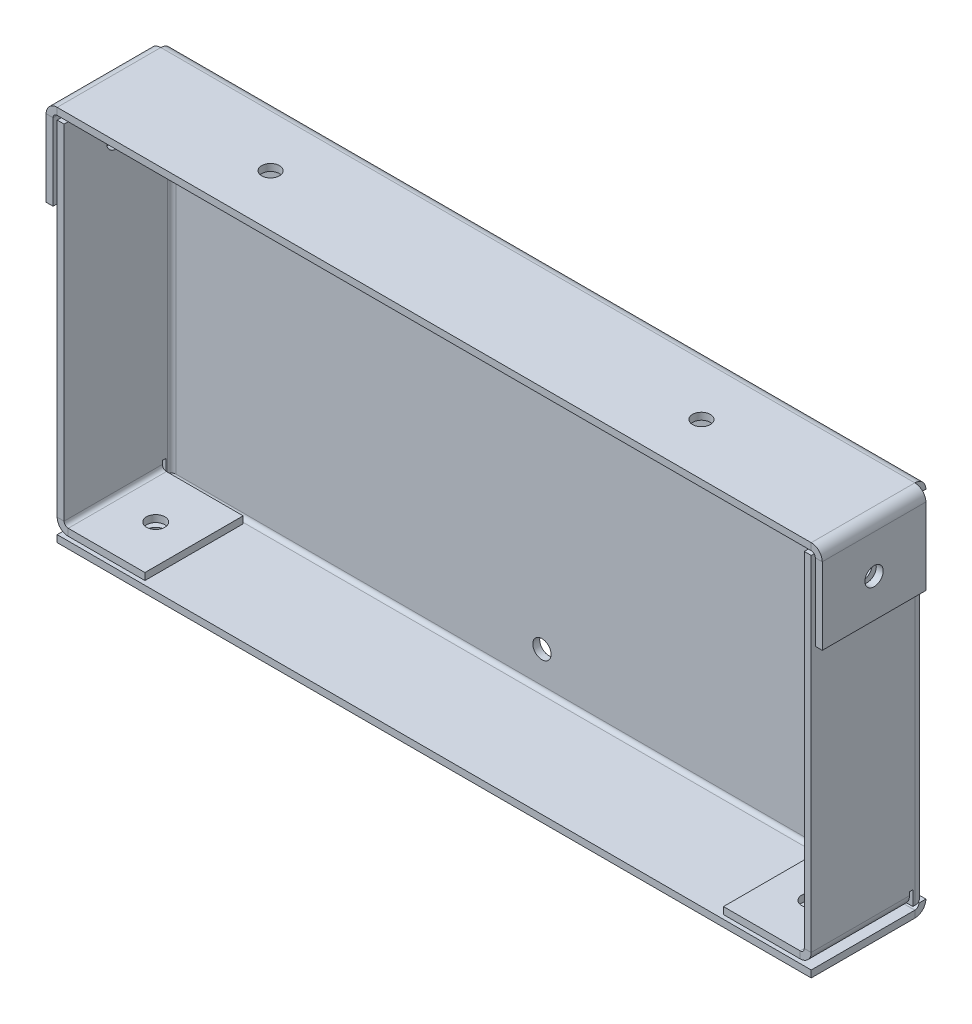
from build123d import *

# Parameters (mm, degrees)
SKETCH1_W                        = 140
SKETCH1_H                        = 70
BASE_FLANGE1_DEPTH               = 1.29
EDGE_FLANGE1_STRIP_W             = 6.684
EDGE_FLANGE1_STRIP_H             = 1.29
EDGE_FLANGE1_STRIP_CUT_DEPTH     = 140
EDGE_FLANGE1_DEPTH               = 140
EDGE_FLANGE2_STRIP_W             = 6.684
EDGE_FLANGE2_STRIP_H             = 1.29
EDGE_FLANGE2_STRIP_CUT_DEPTH     = 140
EDGE_FLANGE2_DEPTH               = 140
EDGE_FLANGE3_STRIP_W             = 6.684
EDGE_FLANGE3_STRIP_H             = 1.29
EDGE_FLANGE3_STRIP_CUT_DEPTH     = 65.896
EDGE_FLANGE3_DEPTH               = 65.896
EDGE_FLANGE4_STRIP_W             = 6.684
EDGE_FLANGE4_STRIP_H             = 1.29
EDGE_FLANGE4_STRIP_CUT_DEPTH     = 65.896
EDGE_FLANGE4_DEPTH               = 65.896
EDGE_FLANGE6_START               = 1.117
EDGE_FLANGE6_DEPTH               = 18.883
EDGE_FLANGE6_2_DEPTH             = 0.645
EDGE_FLANGE6_START_2             = 1.762
EDGE_FLANGE6_3_DEPTH             = 18.238
EDGE_FLANGE8_START               = 1.117
EDGE_FLANGE8_DEPTH               = 18.883
EDGE_FLANGE8_2_DEPTH             = 0.645
EDGE_FLANGE8_START_2             = 1.762
EDGE_FLANGE8_3_DEPTH             = 18.238
M3_CLEARANCE_HOLE1_D             = 3.4
EDGE_FLANGE9_DEPTH               = 19.238
EDGE_FLANGE10_DEPTH              = 19.238
TAP_DRILL_FOR_M4X0_7_TAP1_REACH  = 161.621
TAP_DRILL_FOR_M4X0_7_TAP1_BORE_R = 1.65
M3_CLEARANCE_HOLE3_D             = 3.4
M3_CLEARANCE_HOLE3_DEPTH         = 3.342
M3_CLEARANCE_HOLE4_D             = 3.4


# Read off the part's stored shape, not the designer's step: Edge-Flange6, Edge-Flange8
# Sheet-metal steps are written as plain solids
with BuildPart() as part:
    # Sketch1 → Base-Flange1 (new body)
    with BuildSketch(Plane.XY):
        with Locations((70, 35)):
            Rectangle(SKETCH1_W, SKETCH1_H)
    extrude(amount=-BASE_FLANGE1_DEPTH)

    # Edge-Flange1 strip (across the edge) → Edge-Flange1 strip cut (cut)
    with BuildSketch(Plane(origin=(140, 70, 0), x_dir=(0, -1, 0), z_dir=(-1, 0, 0))):
        with Locations((-1.29, -0.645)):
            Rectangle(EDGE_FLANGE1_STRIP_W, EDGE_FLANGE1_STRIP_H)
    extrude(amount=EDGE_FLANGE1_STRIP_CUT_DEPTH, mode=Mode.SUBTRACT)

    # Edge-Flange1 section (across the edge) → Edge-Flange1 (add)
    with BuildSketch(Plane(origin=(140, 70, 0), x_dir=(0, -1, 0), z_dir=(-1, 0, 0))):
        with BuildLine():
            Line((0, 0.762), (0, 20))
            Line((0, 20), (1.29, 20))
            Line((1.29, 20), (1.29, 0.762))
            ThreePointArc((1.29, 0.762), (1.513184633, 0.223184633), (2.052, 0))
            Line((2.052, 0), (2.052, -1.29))
            ThreePointArc((2.052, -1.29), (0.601016885, -0.688983115), (0, 0.762))
        make_face()
    extrude(amount=EDGE_FLANGE1_DEPTH)

    # Edge-Flange2 strip (across the edge) → Edge-Flange2 strip cut (cut)
    with BuildSketch(Plane.YZ):
        with Locations((-1.29, -0.645)):
            Rectangle(EDGE_FLANGE2_STRIP_W, EDGE_FLANGE2_STRIP_H)
    extrude(amount=EDGE_FLANGE2_STRIP_CUT_DEPTH, mode=Mode.SUBTRACT)

    # Edge-Flange2 section (across the edge) → Edge-Flange2 (add)
    with BuildSketch(Plane.YZ):
        with BuildLine():
            Line((0, 0.762), (0, 20))
            Line((0, 20), (1.29, 20))
            Line((1.29, 20), (1.29, 0.762))
            ThreePointArc((1.29, 0.762), (1.513184633, 0.223184633), (2.052, 0))
            Line((2.052, 0), (2.052, -1.29))
            ThreePointArc((2.052, -1.29), (0.601016885, -0.688983115), (0, 0.762))
        make_face()
    extrude(amount=EDGE_FLANGE2_DEPTH)

    # Edge-Flange3 strip (across the edge) → Edge-Flange3 strip cut (cut)
    with BuildSketch(Plane.XZ.offset(-67.948)):
        with Locations((-1.29, -0.645)):
            Rectangle(EDGE_FLANGE3_STRIP_W, EDGE_FLANGE3_STRIP_H)
    extrude(amount=EDGE_FLANGE3_STRIP_CUT_DEPTH, mode=Mode.SUBTRACT)

    # Edge-Flange3 section (across the edge) → Edge-Flange3 (add)
    with BuildSketch(Plane.XZ.offset(-67.948)):
        with BuildLine():
            Line((0, 0.762), (0, 20))
            Line((0, 20), (1.29, 20))
            Line((1.29, 20), (1.29, 0.762))
            ThreePointArc((1.29, 0.762), (1.513184633, 0.223184633), (2.052, 0))
            Line((2.052, 0), (2.052, -1.29))
            ThreePointArc((2.052, -1.29), (0.601016885, -0.688983115), (0, 0.762))
        make_face()
    extrude(amount=EDGE_FLANGE3_DEPTH)

    # Edge-Flange4 strip (across the edge) → Edge-Flange4 strip cut (cut)
    with BuildSketch(Plane(origin=(140, 2.052, 0), x_dir=(-1, 0, 0), z_dir=(0, 1, 0))):
        with Locations((-1.29, -0.645)):
            Rectangle(EDGE_FLANGE4_STRIP_W, EDGE_FLANGE4_STRIP_H)
    extrude(amount=EDGE_FLANGE4_STRIP_CUT_DEPTH, mode=Mode.SUBTRACT)

    # Edge-Flange4 section (across the edge) → Edge-Flange4 (add)
    with BuildSketch(Plane(origin=(140, 2.052, 0), x_dir=(-1, 0, 0), z_dir=(0, 1, 0))):
        with BuildLine():
            Line((0, 0.762), (0, 20))
            Line((0, 20), (1.29, 20))
            Line((1.29, 20), (1.29, 0.762))
            ThreePointArc((1.29, 0.762), (1.513184633, 0.223184633), (2.052, 0))
            Line((2.052, 0), (2.052, -1.29))
            ThreePointArc((2.052, -1.29), (0.601016885, -0.688983115), (0, 0.762))
        make_face()
    extrude(amount=EDGE_FLANGE4_DEPTH)

    # Edge-Flange6 outline → Edge-Flange6 (cut)
    with BuildSketch(Plane.XY.offset(EDGE_FLANGE6_START)):
        with BuildLine():
            Line((1.29, 2.052), (1.29, 2.198728366))
            ThreePointArc((1.29, 2.198728366), (0.352834322, 2.953547915), (0, 4.104))
            Line((0, 4.104), (0, 2.052))
            Line((0, 2.052), (1.29, 2.052))
        make_face()
    extrude(amount=EDGE_FLANGE6_DEPTH, mode=Mode.SUBTRACT)

    # Edge-Flange6 2 outline → Edge-Flange6 2 (cut)
    with BuildSketch(Plane.XY.offset(EDGE_FLANGE6_START)):
        with BuildLine():
            ThreePointArc((0, 4.104), (0.352834322, 2.953547915), (1.29, 2.198728366))
            Line((1.29, 2.198728366), (1.29, 4.749))
            Line((1.29, 4.749), (0, 4.749))
            Line((0, 4.749), (0, 4.104))
        make_face()
    extrude(amount=EDGE_FLANGE6_2_DEPTH, mode=Mode.SUBTRACT)

    # Edge-Flange6 3 outline → Edge-Flange6 3 (add)
    with BuildSketch(Plane.XY.offset(EDGE_FLANGE6_START_2)):
        with BuildLine():
            Line((2.052, 2.052), (16.29, 2.052))
            Line((16.29, 2.052), (16.29, 3.342))
            Line((16.29, 3.342), (2.052, 3.342))
            ThreePointArc((2.052, 3.342), (1.513184633, 3.565184633), (1.29, 4.104))
            Line((1.29, 4.104), (1.29, 2.198728366))
            ThreePointArc((1.29, 2.198728366), (1.664000898, 2.089015956), (2.052, 2.052))
        make_face()
    extrude(amount=EDGE_FLANGE6_3_DEPTH)

    # Edge-Flange8 outline → Edge-Flange8 (cut)
    with BuildSketch(Plane.XY.offset(EDGE_FLANGE8_START)):
        with BuildLine():
            ThreePointArc((140, 4.104), (139.647165678, 2.953547915), (138.71, 2.198728366))
            Line((138.71, 2.198728366), (138.71, 2.052))
            Line((138.71, 2.052), (140, 2.052))
            Line((140, 2.052), (140, 4.104))
        make_face()
    extrude(amount=EDGE_FLANGE8_DEPTH, mode=Mode.SUBTRACT)

    # Edge-Flange8 2 outline → Edge-Flange8 2 (cut)
    with BuildSketch(Plane.XY.offset(EDGE_FLANGE8_START)):
        with BuildLine():
            Line((138.71, 4.749), (138.71, 2.198728366))
            ThreePointArc((138.71, 2.198728366), (139.647165678, 2.953547915), (140, 4.104))
            Line((140, 4.104), (140, 4.749))
            Line((140, 4.749), (138.71, 4.749))
        make_face()
    extrude(amount=EDGE_FLANGE8_2_DEPTH, mode=Mode.SUBTRACT)

    # Edge-Flange8 3 outline → Edge-Flange8 3 (add)
    with BuildSketch(Plane.XY.offset(EDGE_FLANGE8_START_2)):
        with BuildLine():
            Line((123.71, 2.052), (137.948, 2.052))
            ThreePointArc((137.948, 2.052), (138.335999102, 2.089015956), (138.71, 2.198728366))
            Line((138.71, 2.198728366), (138.71, 4.104))
            ThreePointArc((138.71, 4.104), (138.486815367, 3.565184633), (137.948, 3.342))
            Line((137.948, 3.342), (123.71, 3.342))
            Line((123.71, 3.342), (123.71, 2.052))
        make_face()
    extrude(amount=EDGE_FLANGE8_3_DEPTH)

    # M3 Clearance Hole1 (through all)
    with Locations(Plane(origin=(34.266060613, 19.783275694, -1.29), x_dir=(-1, 0, 0), z_dir=(0, 0, -1))):
        with Locations((-35.733939387, -11.902275694)):
            Hole(M3_CLEARANCE_HOLE1_D / 2)

    # Edge-Flange9 section (across the edge) → Edge-Flange9 (add)
    with BuildSketch(Plane(origin=(140.762, 68.71, 0.762), x_dir=(-1, 0, 0), z_dir=(0, 0, 1))):
        with BuildLine():
            Line((-1.29, 0.762), (-1.29, 15))
            Line((-1.29, 15), (0, 15))
            Line((0, 15), (0, 0.762))
            ThreePointArc((0, 0.762), (0.223184633, 0.223184633), (0.762, 0))
            Line((0.762, 0), (0.762, -1.29))
            ThreePointArc((0.762, -1.29), (-0.688983115, -0.688983115), (-1.29, 0.762))
        make_face()
    extrude(amount=EDGE_FLANGE9_DEPTH)

    # Edge-Flange10 section (across the edge) → Edge-Flange10 (add)
    with BuildSketch(Plane(origin=(-0.762, 68.71, 20), x_dir=(1, 0, 0), z_dir=(0, 0, -1))):
        with BuildLine():
            Line((-1.29, 0.762), (-1.29, 15))
            Line((-1.29, 15), (0, 15))
            Line((0, 15), (0, 0.762))
            ThreePointArc((0, 0.762), (0.223184633, 0.223184633), (0.762, 0))
            Line((0.762, 0), (0.762, -1.29))
            ThreePointArc((0.762, -1.29), (-0.688983115, -0.688983115), (-1.29, 0.762))
        make_face()
    extrude(amount=EDGE_FLANGE10_DEPTH)

    # Tap Drill for M4x0.7 Tap1 bore → Tap Drill for M4x0.7 Tap1 (cut, up to next)
    with BuildSketch(Plane(origin=(0, 70, 0), x_dir=(1, 0, 0), z_dir=(0, 1, 0)), mode=Mode.PRIVATE) as tap_drill_for_m4x0_7_tap1_sk1:
        with Locations((30, -10.381)):
            Circle(TAP_DRILL_FOR_M4X0_7_TAP1_BORE_R)
    tap_drill_for_m4x0_7_tap1_tool1 = extrude(tap_drill_for_m4x0_7_tap1_sk1.sketch, amount=-TAP_DRILL_FOR_M4X0_7_TAP1_REACH, mode=Mode.PRIVATE) & part.part
    # Tap Drill for M4x0.7 Tap1 bore → Tap Drill for M4x0.7 Tap1 (cut, up to next)
    with BuildSketch(Plane(origin=(0, 70, 0), x_dir=(1, 0, 0), z_dir=(0, 1, 0)), mode=Mode.PRIVATE) as tap_drill_for_m4x0_7_tap1_sk2:
        with Locations((110, -10.381)):
            Circle(TAP_DRILL_FOR_M4X0_7_TAP1_BORE_R)
    tap_drill_for_m4x0_7_tap1_tool2 = extrude(tap_drill_for_m4x0_7_tap1_sk2.sketch, amount=-TAP_DRILL_FOR_M4X0_7_TAP1_REACH, mode=Mode.PRIVATE) & part.part
    add(tap_drill_for_m4x0_7_tap1_tool1.solids().sort_by_distance((30, 70, 10.381))[0], mode=Mode.SUBTRACT)
    add(tap_drill_for_m4x0_7_tap1_tool2.solids().sort_by_distance((110, 70, 10.381))[0], mode=Mode.SUBTRACT)

    # M3 Clearance Hole3
    with Locations(Plane(origin=(0, 3.342, 0), x_dir=(1, 0, 0), z_dir=(0, 1, 0))):
        with Locations((9.171, -10.881), (130.829, -10.881)):
            Hole(M3_CLEARANCE_HOLE3_D / 2, depth=M3_CLEARANCE_HOLE3_DEPTH)

    # M3 Clearance Hole4 (through all)
    with Locations(Plane(origin=(142.052, 0, 0), x_dir=(0, 0, -1), z_dir=(1, 0, 0))):
        with Locations((-10.381, 60.829)):
            Hole(M3_CLEARANCE_HOLE4_D / 2)


solid = part.part
